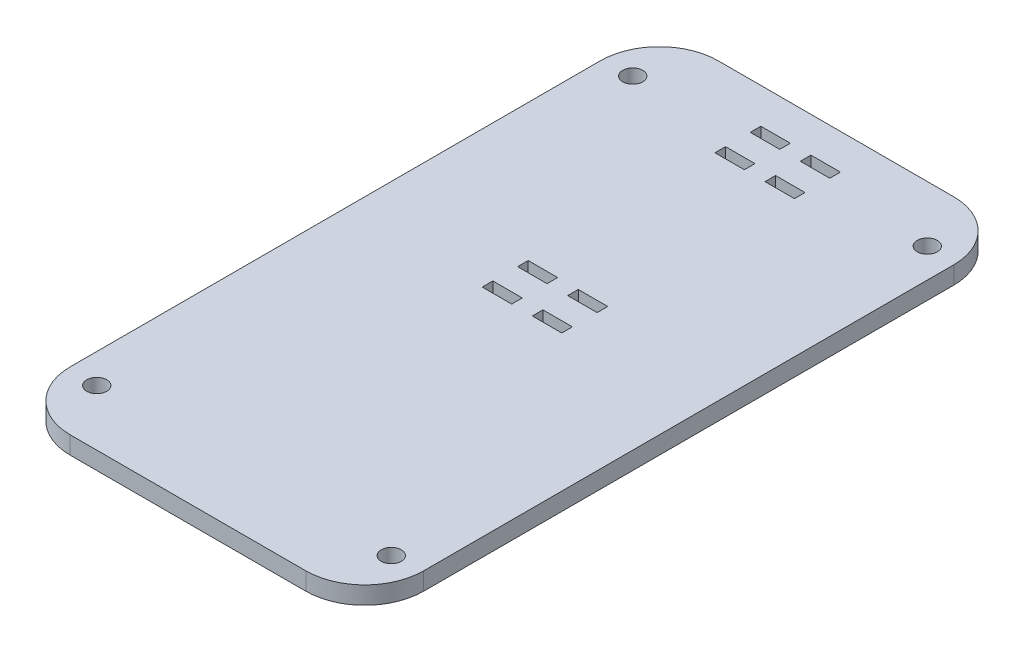
from build123d import *

# Parameters (mm, degrees)
SKETCH1_W             = 60
SKETCH1_H             = 110
BOSS_EXTRUDE1_DEPTH   = 3
FILLET2_R             = 10
M3_CLEARANCE_HOLE1_D  = 3.4
DELETEFACE1_OUTLINE_R = 1.7
DELETEFACE1_DEPTH     = 3
SKETCH6_W             = 5
SKETCH6_H             = 1.8
CUT_EXTRUDE3_DEPTH    = 63.721607122


# Read off the part's stored shape, not the designer's step: DeleteFace1
with BuildPart() as part:
    # Sketch1 → Boss-Extrude1 (new body)
    with BuildSketch(Plane(origin=(0, 0, 0), x_dir=(1, 0, 0), z_dir=(0, 1, 0))):
        Rectangle(SKETCH1_W, SKETCH1_H)
    extrude(amount=BOSS_EXTRUDE1_DEPTH)

    # Fillet2
    fillet2_edges = [part.edges().sort_by_distance(p)[0] for p in [
        (30, 1.5, 55),
        (-30, 1.5, 55),
        (-30, 1.5, -55),
        (30, 1.5, -55),
    ]]
    fillet(fillet2_edges, radius=FILLET2_R)

    # M3 Clearance Hole1 (through all)
    with Locations(Plane(origin=(0, 3, 0), x_dir=(1, 0, 0), z_dir=(0, 1, 0))):
        with Locations((0, 0), (25, 45.5), (-25, -45.5), (-25, 45.5), (25, -45.5)):
            Hole(M3_CLEARANCE_HOLE1_D / 2)

    # DeleteFace1 outline → DeleteFace1 (add)
    with BuildSketch(Plane(origin=(0, 0, 0), x_dir=(1, 0, 0), z_dir=(0, 1, 0))):
        Circle(DELETEFACE1_OUTLINE_R)
    extrude(amount=DELETEFACE1_DEPTH)

    # Sketch6 → Cut-Extrude3 (cut, through all)
    with BuildSketch(Plane(origin=(0, 3, 0), x_dir=(1, 0, 0), z_dir=(0, 1, 0))):
        with Locations((-4.25, 2.6)):
            Rectangle(SKETCH6_W, SKETCH6_H)
        with Locations((4.25, 2.6)):
            Rectangle(SKETCH6_W, SKETCH6_H)
        with Locations((4.25, 8.6)):
            Rectangle(SKETCH6_W, SKETCH6_H)
        with Locations((-4.25, 8.6)):
            Rectangle(SKETCH6_W, SKETCH6_H)
        with Locations((-4.25, 42.1)):
            Rectangle(SKETCH6_W, SKETCH6_H)
        with Locations((-4.25, 48.1)):
            Rectangle(SKETCH6_W, SKETCH6_H)
        with Locations((4.25, 48.1)):
            Rectangle(SKETCH6_W, SKETCH6_H)
        with Locations((4.25, 42.1)):
            Rectangle(SKETCH6_W, SKETCH6_H)
    extrude(amount=-CUT_EXTRUDE3_DEPTH, mode=Mode.SUBTRACT)


solid = part.part
